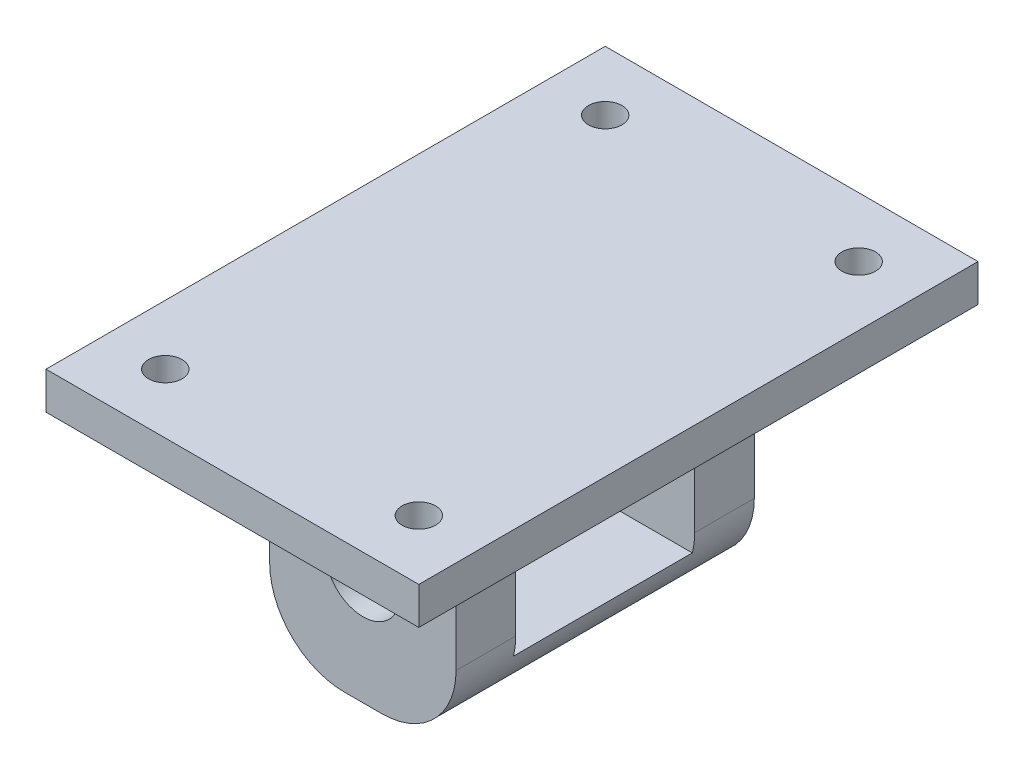
from build123d import *

# Parameters (mm, degrees)
SKETCH1_W                      = 25
SKETCH1_H                      = 30
BOSS_EXTRUDE1_DEPTH            = 20
CUT_EXTRUDE1_DEPTH             = 12
CUT_EXTRUDE1_DEPTH_BACK        = 12
SKETCH3_R                      = 5
CUT_EXTRUDE2_DEPTH             = 45.511234537
SKETCH4_W                      = 50
SKETCH4_H                      = 75
BOSS_EXTRUDE2_DEPTH            = 5
FILLET1_R                      = 10
M4_CLEARANCE_HOLE1_D           = 4.5
M4_CLEARANCE_HOLE1_CSINK_D     = 4.55
M4_CLEARANCE_HOLE1_CSINK_ANGLE = 90


with BuildPart() as part:
    # Sketch1 → Boss-Extrude1 (new, symmetric)
    with BuildSketch(Plane.XY):
        Rectangle(SKETCH1_W, SKETCH1_H)
    extrude(amount=BOSS_EXTRUDE1_DEPTH, both=True)

    # Sketch2 → Cut-Extrude1 (cut, two sides: drawn at the far end of the back side and taken through both)
    with BuildSketch(Plane.XY.offset(-CUT_EXTRUDE1_DEPTH_BACK)):
        with BuildLine():
            Line((0, 7.5), (21.39891064, 7.5))
            Line((21.39891064, 7.5), (21.39891064, -7.5))
            Line((21.39891064, -7.5), (0, -7.5))
            ThreePointArc((0, -7.5), (-7.5, 0), (0, 7.5))
        make_face()
    extrude(amount=CUT_EXTRUDE1_DEPTH + CUT_EXTRUDE1_DEPTH_BACK, mode=Mode.SUBTRACT)

    # Sketch3 → Cut-Extrude2 (cut, through all)
    with BuildSketch(Plane.XY.offset(20)):
        Circle(SKETCH3_R)
    extrude(amount=-CUT_EXTRUDE2_DEPTH, mode=Mode.SUBTRACT)

    # Sketch4 → Boss-Extrude2 (add)
    with BuildSketch(Plane(origin=(0, 15, 0), x_dir=(1, 0, 0), z_dir=(0, 1, 0))):
        Rectangle(SKETCH4_W, SKETCH4_H)
    extrude(amount=BOSS_EXTRUDE2_DEPTH)

    # Fillet1
    # the kernel refuses this fillet: 10 mm, written as the material it takes off along each edge
    with BuildSketch(Plane(origin=(-12.5, -15, 45), x_dir=(0, 1, 0), z_dir=(0, 0, -1)), Plane(origin=(12.5, -15, -45), x_dir=(0, 1, 0), z_dir=(0, 0, 1))) as fillet1_piece_1:
        with BuildLine():
            CenterArc((FILLET1_R, FILLET1_R), FILLET1_R, 180, 90)
            Line((0, FILLET1_R), (0, 0))
            Line((0, 0), (FILLET1_R, 0))
        make_face()
    extrude(amount=90, mode=Mode.SUBTRACT)

    # M4 Clearance Hole1 (through all)
    with Locations(Plane(origin=(0, 15, 0), x_dir=(-1, 0, 0), z_dir=(0, -1, 0))):
        with Locations((-17, 29.5), (17, 29.5), (17, -29.5), (-17, -29.5)):
            CounterSinkHole(M4_CLEARANCE_HOLE1_D / 2, M4_CLEARANCE_HOLE1_CSINK_D / 2, counter_sink_angle=M4_CLEARANCE_HOLE1_CSINK_ANGLE)


solid = part.part
